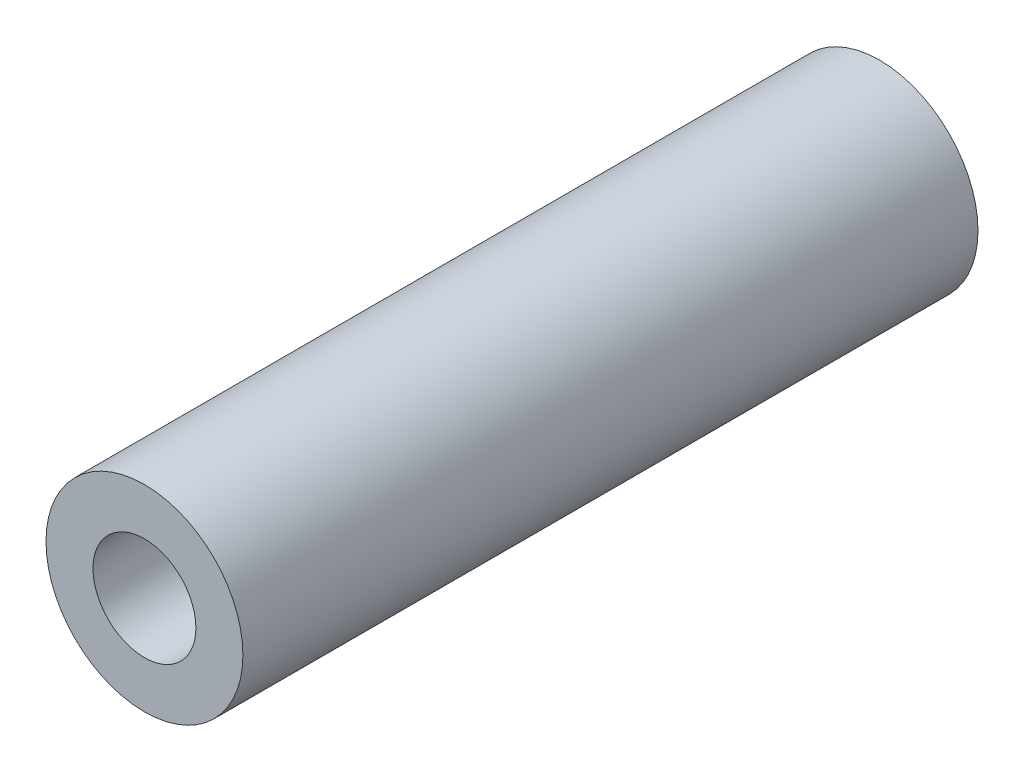
from build123d import *

# Parameters (mm, degrees)
SKETCH1_R           = 4.7625
SKETCH1_R_2         = 2.4892
BOSS_EXTRUDE1_DEPTH = 17.78


with BuildPart() as part:
    # Sketch1 → Boss-Extrude1 (new, symmetric)
    with BuildSketch(Plane.XY):
        Circle(SKETCH1_R)
        Circle(SKETCH1_R_2, mode=Mode.SUBTRACT)
    extrude(amount=BOSS_EXTRUDE1_DEPTH, both=True)


solid = part.part
